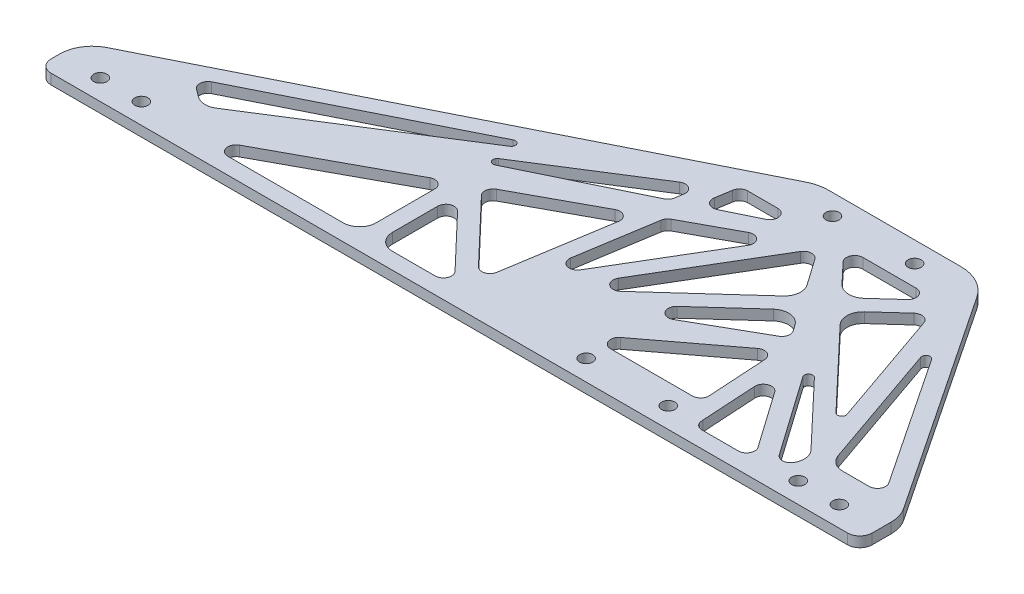
from build123d import *

# Parameters (mm, degrees)
SKETCH1_R           = 2.032
BOSS_EXTRUDE1_DEPTH = 3.175
SKETCH1_3_R         = 2.032
CUT_EXTRUDE2_DEPTH  = 270.126904313
FILLET1_R           = 3.81
FILLET2_R           = 10.16
FILLET3_R           = 12.7
FILLET4_R           = 1.27
FILLET5_R           = 2.54
FILLET6_DEPTH       = 3.175


with BuildPart() as part:
    # Sketch1 → Boss-Extrude1 (new body)
    with BuildSketch(Plane(origin=(0, 0, 0), x_dir=(1, 0, 0), z_dir=(0, 1, 0))):
        Polygon((0, 0), (254, 0), (254, 12.7), (203.2, 88.9), (152.4, 88.9), (0, 12.7), align=None)
        with Locations(Location((12.7, 6.35, 0), (0, 0, 270))):
            Circle(SKETCH1_R, mode=Mode.SUBTRACT)
        with Locations(Location((25.4, 6.35, 0), (0, 0, 270))):
            Circle(SKETCH1_R, mode=Mode.SUBTRACT)
        with Locations(Location((228.6, 6.35, 0), (0, 0, 270))):
            Circle(SKETCH1_R, mode=Mode.SUBTRACT)
        with Locations(Location((241.3, 6.35, 0), (0, 0, 270))):
            Circle(SKETCH1_R, mode=Mode.SUBTRACT)
        with Locations(Location((162.983333333, 82.55, 0), (0, 0, 270))):
            Circle(SKETCH1_R, mode=Mode.SUBTRACT)
        with Locations(Location((188.383333333, 82.55, 0), (0, 0, 270))):
            Circle(SKETCH1_R, mode=Mode.SUBTRACT)
    extrude(amount=BOSS_EXTRUDE1_DEPTH)

    # Sketch1<3> → Cut-Extrude2 (cut, through all)
    with BuildSketch(Plane(origin=(0, 0, 0), x_dir=(1, 0, 0), z_dir=(0, 1, 0))):
        Polygon((115.724624488, 64.882699581), (27.28853263, 20.664653652), (35.82613579, 14.323081227), align=None)
        Polygon((197.627677458, 6.91131175), (198.543333333, 5.08), (216.209513725, 5.08), (196.001097378, 33.83556314), align=None)
        with Locations(Location((162.983333333, 6.35, 0), (0, 0, 270))):
            Circle(SKETCH1_3_R)
        Polygon((190.635905135, 38.402947882), (156.633333333, 12.7), (192.188702367, 12.7), align=None)
        Polygon((94.175435772, 32.591444541), (43.396541726, 5.08), (94.175435772, 5.08), align=None)
        with Locations(Location((188.383333333, 6.35, 0), (0, 0, 270))):
            Circle(SKETCH1_3_R)
        Polygon((99.255435772, 30.509658634), (99.255435772, 5.08), (123.491206376, 5.08), align=None)
        Polygon((163.49857777, 76.2), (140.931419259, 76.2), (139.042658246, 64.374485547), align=None)
        Polygon((191.431375489, 49.173139927), (220.831581656, 7.338120783), (225.073834238, 13.650530069), align=None)
        Polygon((182.993969781, 52.344053487), (145.913976972, 18.776250855), (189.241078693, 43.454730757), align=None)
        Polygon((134.963762863, 71.045523698), (77.053379688, 34.399938534), (133.467710225, 61.678752584), align=None)
        Polygon((229.214596962, 15.811166321), (245.82048896, 15.811166321), (211.171400328, 67.784799269), align=None)
        Polygon((132.104025549, 53.140736008), (100.845083482, 36.204986082), (125.300627654, 10.544727526), align=None)
        Polygon((169.510067662, 71.530970072), (137.832506287, 18.312666963), (180.050783748, 56.53205963), align=None)
        Polygon((186.192725225, 62.092240839), (201.77657544, 76.2), (172.831665677, 76.2), align=None)
        Polygon((162.432346465, 69.572285661), (137.735749394, 56.191941851), (131.599534907, 17.773162244), align=None)
        Polygon((189.686775345, 58.402921334), (220.256823492, 26.124427609), (204.420515632, 71.741092366), align=None)
    extrude(amount=CUT_EXTRUDE2_DEPTH, mode=Mode.SUBTRACT)

    # Fillet1
    fillet1_edges = [part.edges().sort_by_distance(p)[0] for p in [
        (0, 1.5875, 0),
        (254, 1.5875, 0),
    ]]
    fillet(fillet1_edges, radius=FILLET1_R)

    # Fillet2
    fillet2_edges = [part.edges().sort_by_distance(p)[0] for p in [
        (254, 1.5875, -12.7),
        (0, 1.5875, -12.7),
    ]]
    fillet(fillet2_edges, radius=FILLET2_R)

    # Fillet3
    fillet3_edges = [part.edges().sort_by_distance(p)[0] for p in [
        (203.2, 1.5875, -88.9),
        (152.4, 1.5875, -88.9),
    ]]
    fillet(fillet3_edges, radius=FILLET3_R)

    # Fillet4
    fillet4_edges = [part.edges().sort_by_distance(p)[0] for p in [
        (220.256823492, 1.5875, -26.124427609),
        (211.171400328, 1.5875, -67.784799269),
        (191.431375489, 1.5875, -49.173139927),
        (115.724624488, 1.5875, -64.882699581),
        (77.053379688, 1.5875, -34.399938534),
    ]]
    fillet(fillet4_edges, radius=FILLET4_R)

    # Fillet5
    fillet5_edges = [part.edges().sort_by_distance(p)[0] for p in [
        (172.831665677, 1.5875, -76.2),
        (204.420515632, 1.5875, -71.741092366),
        (131.599534907, 1.5875, -17.773162244),
        (162.432346465, 1.5875, -69.572285661),
        (137.735749394, 1.5875, -56.191941851),
        (169.510067662, 1.5875, -71.530970072),
        (137.832506287, 1.5875, -18.312666963),
        (196.001097378, 1.5875, -33.83556314),
        (198.543333333, 1.5875, -5.08),
        (216.209513725, 1.5875, -5.08),
        (145.913976972, 1.5875, -18.776250855),
        (189.241078693, 1.5875, -43.454730757),
        (245.82048896, 1.5875, -15.811166321),
        (220.831581656, 1.5875, -7.338120783),
        (94.175435772, 1.5875, -32.591444541),
        (43.396541726, 1.5875, -5.08),
        (27.28853263, 1.5875, -20.664653652),
        (140.931419259, 1.5875, -76.2),
        (139.042658246, 1.5875, -64.374485547),
        (163.49857777, 1.5875, -76.2),
        (134.963762863, 1.5875, -71.045523698),
        (133.467710225, 1.5875, -61.678752584),
        (123.491206376, 1.5875, -5.08),
        (99.255435772, 1.5875, -30.509658634),
        (125.300627654, 1.5875, -10.544727526),
        (132.104025549, 1.5875, -53.140736008),
        (100.845083482, 1.5875, -36.204986082),
        (190.635905135, 1.5875, -38.402947882),
        (156.633333333, 1.5875, -12.7),
        (192.188702367, 1.5875, -12.7),
        (201.77657544, 1.5875, -76.2),
    ]]
    fillet(fillet5_edges, radius=FILLET5_R)

    # Fillet6: read off the stored shape, not the designer's step
    # Fillet6 outline → Fillet6 (add)
    with BuildSketch(Plane(origin=(0, 0, 0), x_dir=(1, 0, 0), z_dir=(0, 1, 0))):
        with BuildLine():
            Line((197.627677458, 6.91131175), (197.8412946, 6.484077467))
            ThreePointArc((197.8412946, 6.484077467), (197.660329187, 7.15163193), (197.571718595, 7.837580619))
            Line((197.571718595, 7.837580619), (197.627677458, 6.91131175))
        make_face()
        with BuildLine():
            ThreePointArc((38.77257119, 16.18758019), (35.866508895, 15.403840031), (33.027019658, 16.402212494))
            Line((33.027019658, 16.402212494), (35.82613579, 14.323081227))
            Line((35.82613579, 14.323081227), (38.77257119, 16.18758019))
        make_face()
        with BuildLine():
            Line((229.214596962, 15.811166321), (232.828436892, 15.811166321))
            ThreePointArc((232.828436892, 15.811166321), (229.883700891, 16.751730382), (228.029403022, 19.225130932))
            Line((228.029403022, 19.225130932), (229.214596962, 15.811166321))
        make_face()
        with BuildLine():
            Line((225.073834238, 13.650530069), (222.279686918, 16.600831826))
            ThreePointArc((222.279686918, 16.600831826), (223.646593023, 13.608087476), (222.892967422, 10.405432406))
            Line((222.892967422, 10.405432406), (225.073834238, 13.650530069))
        make_face()
        with BuildLine():
            Line((94.175435772, 5.08), (94.175435772, 10.16))
            ThreePointArc((94.175435772, 10.16), (92.687538221, 6.567897552), (89.095435772, 5.08))
            Line((89.095435772, 5.08), (94.175435772, 5.08))
        make_face()
        with BuildLine():
            ThreePointArc((104.335435772, 5.08), (100.743333324, 6.567897552), (99.255435772, 10.16))
            Line((99.255435772, 10.16), (99.255435772, 5.08))
            Line((99.255435772, 5.08), (104.335435772, 5.08))
        make_face()
        with BuildLine():
            Line((189.686775345, 58.402921334), (193.259422183, 54.630612636))
            ThreePointArc((193.259422183, 54.630612636), (191.871557973, 58.31892969), (193.538494235, 61.889808188))
            Line((193.538494235, 61.889808188), (189.686775345, 58.402921334))
        make_face()
        with BuildLine():
            ThreePointArc((189.874971747, 65.425707626), (186.270506771, 64.115486966), (182.777271822, 65.69857115))
            Line((182.777271822, 65.69857115), (186.192725225, 62.092240839))
            Line((186.192725225, 62.092240839), (189.874971747, 65.425707626))
        make_face()
        with BuildLine():
            Line((180.050783748, 56.53205963), (177.469122224, 60.205634526))
            ThreePointArc((177.469122224, 60.205634526), (178.361429352, 56.720772492), (176.722145031, 53.518707171))
            Line((176.722145031, 53.518707171), (180.050783748, 56.53205963))
        make_face()
        with BuildLine():
            ThreePointArc((178.733075257, 48.486747819), (182.706353411, 49.769316538), (186.298680322, 47.641616097))
            Line((186.298680322, 47.641616097), (182.993969781, 52.344053487))
            Line((182.993969781, 52.344053487), (178.733075257, 48.486747819))
        make_face()
    extrude(amount=FILLET6_DEPTH)


solid = part.part
